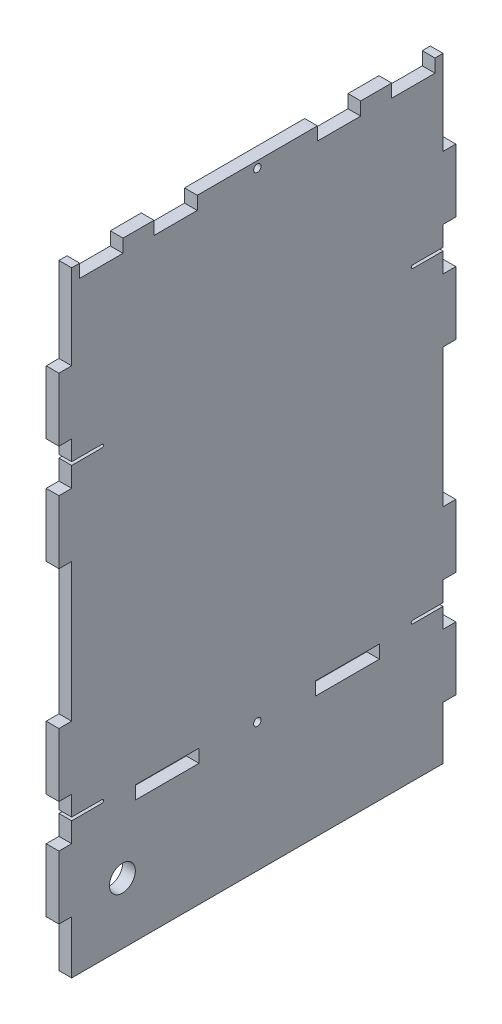
from build123d import *

# Parameters (mm, degrees)
ESBO_O1_W                  = 6
ESBO_O1_H                  = 29.8
RESSALTO_EXTRUS_O3_DEPTH   = 187
RESSALTO_EXTRUS_O3_2_DEPTH = 187
RESSALTO_EXTRUS_O3_3_DEPTH = 187
RESSALTO_EXTRUS_O3_4_DEPTH = 187
ESBO_O2_W                  = 175
ESBO_O2_H                  = 289.8
RESSALTO_EXTRUS_O4_DEPTH   = 6
ESBO_O3_W                  = 15
ESBO_O3_H                  = 1.5
CORTE_EXTRUS_O1_DEPTH      = 6
ESBO_O5_R                  = 1.75
ESBO_O5_W                  = 30
ESBO_O5_H                  = 6.2
CORTE_EXTRUS_O3_DEPTH      = 22.8
ESBO_O6_W                  = 20.4
ESBO_O6_H                  = 6.2
CORTE_EXTRUS_O4_DEPTH      = 14.6
FILETE1_R                  = 0.75
CORTE_EXTRUS_O5_DEPTH      = 10
ESBO_O8_R                  = 6.1
CORTE_EXTRUS_O6_DEPTH      = 22


with BuildPart() as part:
    # Esboço1 → Ressalto-extrusão3 (new body)
    with BuildSketch(Plane.XY):
        with Locations((3, 39)):
            Rectangle(ESBO_O1_W, ESBO_O1_H)
    extrude(amount=-RESSALTO_EXTRUS_O3_DEPTH)



with BuildPart() as body_2:
    # Esboço1 → Ressalto-extrus_o3 2 (new body)
    with BuildSketch(Plane.XY):
        with Locations((3, 89)):
            Rectangle(ESBO_O1_W, ESBO_O1_H)
    extrude(amount=-RESSALTO_EXTRUS_O3_2_DEPTH)


with BuildPart() as body_3:
    # Esboço1 → Ressalto-extrus_o3 3 (new body)
    with BuildSketch(Plane.XY):
        with Locations((3, 184)):
            Rectangle(ESBO_O1_W, ESBO_O1_H)
    extrude(amount=-RESSALTO_EXTRUS_O3_3_DEPTH)


with BuildPart() as body_4:
    # Esboço1 → Ressalto-extrus_o3 4 (new body)
    with BuildSketch(Plane.XY):
        with Locations((3, 234)):
            Rectangle(ESBO_O1_W, ESBO_O1_H)
    extrude(amount=-RESSALTO_EXTRUS_O3_4_DEPTH)


with BuildPart() as part_1:
    add(part.part)

    add(body_2.part)  # Ressalto-extrusão4 merges body 2

    add(body_3.part)  # Ressalto-extrusão4 merges body 3

    add(body_4.part)  # Ressalto-extrusão4 merges body 4
    # Esboço2 → Ressalto-extrusão4 (add)
    with BuildSketch(Plane.ZY):
        with Locations((-93.5, 144)):
            Rectangle(ESBO_O2_W, ESBO_O2_H)
    extrude(amount=-RESSALTO_EXTRUS_O4_DEPTH)

    # Esboço3 → Corte-extrusão1 (cut)
    with BuildSketch(Plane.ZY):
        with Locations((-173.5, 64)):
            Rectangle(ESBO_O3_W, ESBO_O3_H)
        with Locations((-13.5, 64)):
            Rectangle(ESBO_O3_W, ESBO_O3_H)
        with Locations((-13.5, 209)):
            Rectangle(ESBO_O3_W, ESBO_O3_H)
        with Locations((-173.5, 209)):
            Rectangle(ESBO_O3_W, ESBO_O3_H)
    extrude(amount=-CORTE_EXTRUS_O1_DEPTH, mode=Mode.SUBTRACT)

    # Esboço5 → Corte-extrusão3 (cut)
    with BuildSketch(Plane.ZY):
        with Locations(Location((-93.5, 59.8, 0), (0, 0, 270))):
            Circle(ESBO_O5_R)
        with Locations((-136, 59.8)):
            Rectangle(ESBO_O5_W, ESBO_O5_H)
        with Locations((-51, 59.8)):
            Rectangle(ESBO_O5_W, ESBO_O5_H)
    extrude(amount=-CORTE_EXTRUS_O3_DEPTH, mode=Mode.SUBTRACT)

    # Esboço6 → Corte-extrusão4 (cut)
    with BuildSketch(Plane.ZY):
        with Locations((-20, 285.8)):
            Rectangle(ESBO_O6_W, ESBO_O6_H)
        with Locations((-55, 285.8)):
            Rectangle(ESBO_O6_W, ESBO_O6_H)
    corte_extrus_o4 = extrude(amount=-CORTE_EXTRUS_O4_DEPTH, mode=Mode.SUBTRACT)

    # Espelhar1: Corte-extrusão4 across plane
    add(corte_extrus_o4.mirror(Plane.XY.offset(-93.5)), mode=Mode.SUBTRACT)

    # Filete1
    filete1_edges = [part_1.edges().sort_by_distance(p)[0] for p in [
        (3, 64.75, -166),
        (3, 63.25, -166),
        (3, 63.25, -21),
        (3, 64.75, -21),
        (3, 208.25, -21),
        (3, 209.75, -21),
        (3, 208.25, -166),
        (3, 209.75, -166),
    ]]
    fillet(filete1_edges, radius=FILETE1_R - 0.0001)  # a hair under: the kernel refuses the full size

    # Esboço7 → Corte-extrusão5 (cut)
    with BuildSketch(Plane.ZY):
        with BuildLine():
            ThreePointArc((-91.75, 285.8), (-93.404579917, 287.547396637), (-95.239594295, 285.990556265))
            Line((-95.239594295, 285.990556265), (-91.760405705, 285.609443735))
            ThreePointArc((-91.760405705, 285.609443735), (-91.752603363, 285.704579917), (-91.75, 285.8))
        make_face()
        with BuildLine():
            Line((-91.760405705, 285.609443735), (-95.239594295, 285.990556265))
            ThreePointArc((-95.239594295, 285.990556265), (-93.690556265, 284.060405705), (-91.760405705, 285.609443735))
        make_face()
    extrude(amount=-CORTE_EXTRUS_O5_DEPTH, mode=Mode.SUBTRACT)

    # Esboço8 → Corte-extrusão6 (cut)
    with BuildSketch(Plane.ZY):
        with Locations(Location((-29.9, 27.9, 0), (0, 0, 270))):
            Circle(ESBO_O8_R)
    extrude(amount=-CORTE_EXTRUS_O6_DEPTH, mode=Mode.SUBTRACT)


solid = part_1.part
